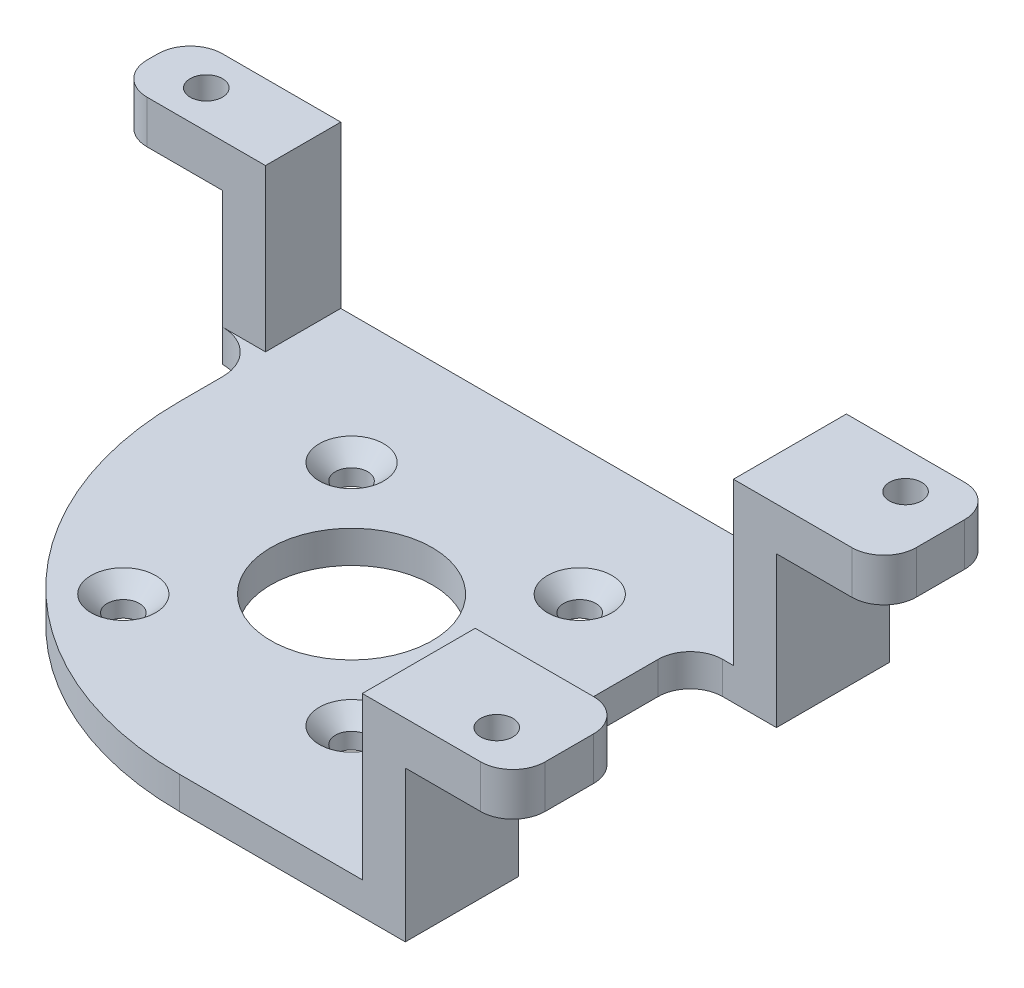
from build123d import *

# Parameters (mm, degrees)
SKETCH_1_W          = 75
SKETCH_1_H          = 45
EXTRUDE_1_DEPTH     = 18
SKETCH_2_W          = 10
SKETCH_2_H          = 45
CUT_EXTRUDE_1_DEPTH = 14
SKETCH_3_W          = 47
SKETCH_3_H          = 45
CUT_EXTRUDE_2_DEPTH = 15
SKETCH_4_R          = 1.5
SKETCH_4_R_2        = 7.5
CUT_EXTRUDE_3_DEPTH = 48.291648311
SKETCH_5_W          = 14
SKETCH_5_H          = 38
CUT_EXTRUDE_4_DEPTH = 48.291648311
FILLET_1_R          = 30
CHAMFER_1_SIZE      = 1.5
SKETCH_8_W          = 36
SKETCH_8_H          = 24
CUT_EXTRUDE_6_DEPTH = 48.291648311
FILLET_2_R          = 3
SKETCH_9_R          = 1.5
CUT_EXTRUDE_7_DEPTH = 46.918405896
FILLET_3_R          = 3
FILLET_4_R          = 4
SKETCH_10_W         = 113.481705681
SKETCH_10_H         = 81.455057911
CUT_EXTRUDE_9_DEPTH = 136.596828871


with BuildPart() as part:
    # 草图1 → 凸台-拉伸1 (new body)
    with BuildSketch(Plane(origin=(0, 0, 0), x_dir=(1, 0, 0), z_dir=(0, 1, 0))):
        Rectangle(SKETCH_1_W, SKETCH_1_H)
    extrude(amount=EXTRUDE_1_DEPTH)

    # 草图2 → 切除-拉伸1 (cut)
    with BuildSketch(Plane.XZ):
        with Locations((-32.5, 0)):
            Rectangle(SKETCH_2_W, SKETCH_2_H)
        with Locations((32.5, 0)):
            Rectangle(SKETCH_2_W, SKETCH_2_H)
    extrude(amount=-CUT_EXTRUDE_1_DEPTH, mode=Mode.SUBTRACT)

    # 草图3 → 切除-拉伸2 (cut)
    with BuildSketch(Plane(origin=(0, 18, 0), x_dir=(1, 0, 0), z_dir=(0, 1, 0))):
        Rectangle(SKETCH_3_W, SKETCH_3_H)
    extrude(amount=-CUT_EXTRUDE_2_DEPTH, mode=Mode.SUBTRACT)

    # 草图4 → 切除-拉伸3 (cut, through all)
    with BuildSketch(Plane.XZ):
        with Locations(Location((10.606601718, 10.606601718, 0), (0, 0, 270))):
            Circle(SKETCH_4_R)
        with Locations(Location((10.606601718, -10.606601718, 0), (0, 0, 270))):
            Circle(SKETCH_4_R)
        with Locations(Location((-10.606601718, -10.606601718, 0), (0, 0, 270))):
            Circle(SKETCH_4_R)
        with Locations(Location((-10.606601718, 10.606601718, 0), (0, 0, 270))):
            Circle(SKETCH_4_R)
        with Locations(Location((0, 0, 0), (0, 0, 270))):
            Circle(SKETCH_4_R_2)
    extrude(amount=-CUT_EXTRUDE_3_DEPTH, mode=Mode.SUBTRACT)

    # 草图5 → 切除-拉伸4 (cut, through all)
    with BuildSketch(Plane(origin=(0, 18, 0), x_dir=(1, 0, 0), z_dir=(0, 1, 0))):
        with Locations((30.5, -3.5)):
            Rectangle(SKETCH_5_W, SKETCH_5_H)
    extrude(amount=-CUT_EXTRUDE_4_DEPTH, mode=Mode.SUBTRACT)

    # 圆角1
    fillet_1_edges = [part.edges().sort_by_distance(p)[0] for p in [
        (23.5, 1.5, 22.5),
    ]]
    fillet(fillet_1_edges, radius=FILLET_1_R)

    # 倒角1
    chamfer_1_edges = [part.edges().sort_by_distance(p)[0] for p in [
        (-10.606601718, 3, 12.106601718),
        (-10.606601718, 3, -9.106601718),
        (10.606601718, 3, -9.106601718),
        (10.606601718, 3, 12.106601718),
    ]]
    chamfer(chamfer_1_edges, length=CHAMFER_1_SIZE)

    # 草图8 → 切除-拉伸6 (cut, through all)
    with BuildSketch(Plane.XZ):
        with Locations((-37.5, 0)):
            Rectangle(SKETCH_8_W, SKETCH_8_H)
    extrude(amount=-CUT_EXTRUDE_6_DEPTH, mode=Mode.SUBTRACT)

    # 圆角2
    fillet_2_edges = [part.edges().sort_by_distance(p)[0] for p in [
        (-19.5, 1.5, 12),
        (-19.5, 1.5, -12),
    ]]
    fillet(fillet_2_edges, radius=FILLET_2_R)

    # 草图9 → 切除-拉伸7 (cut, through all)
    with BuildSketch(Plane.XZ.offset(-14)):
        with Locations(Location((32.5, -19, 0), (0, 0, 270))):
            Circle(SKETCH_9_R)
        with Locations(Location((-32.5, -19, 0), (0, 0, 270))):
            Circle(SKETCH_9_R)
        with Locations(Location((-32.5, 19, 0), (0, 0, 270))):
            Circle(SKETCH_9_R)
    extrude(amount=-CUT_EXTRUDE_7_DEPTH, mode=Mode.SUBTRACT)

    # 圆角3
    fillet_3_edges = [part.edges().sort_by_distance(p)[0] for p in [
        (-37.5, 16, 12),
        (-37.5, 16, -12),
        (-37.5, 16, 22.5),
        (-37.5, 16, -22.5),
        (37.5, 16, -22.5),
        (37.5, 16, -15.5),
    ]]
    fillet(fillet_3_edges, radius=FILLET_3_R)

    # 圆角4
    fillet_4_edges = [part.edges().sort_by_distance(p)[0] for p in [
        (23.5, 1.5, -15.5),
    ]]
    fillet(fillet_4_edges, radius=FILLET_4_R - 0.0001)  # a hair under: the kernel refuses the full size


with BuildPart() as body_2:
    # 镜向1: mirrored copy
    add(part.part.mirror(Plane.ZY.offset(47.5)))


with BuildPart() as part_1:
    add(part.part)

    # 草图10 → 切除-拉伸9 (cut, through all)
    with BuildSketch(Plane.XZ):
        with Locations((9.796228236, -0.64793796)):
            Rectangle(SKETCH_10_W, SKETCH_10_H)
    extrude(amount=-CUT_EXTRUDE_9_DEPTH, mode=Mode.SUBTRACT)


solid = body_2.part
